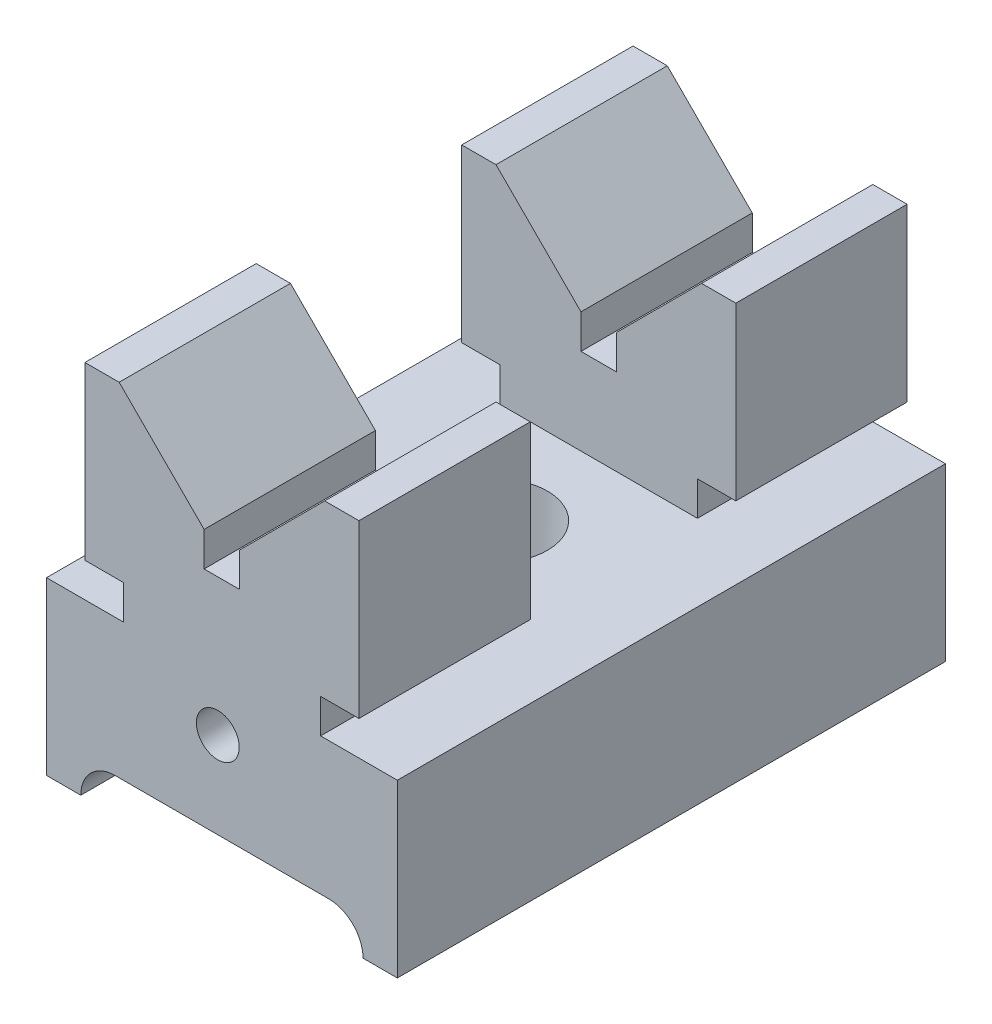
from build123d import *

# Parameters (mm, degrees)
BOSS_EXTRUDE1_DEPTH          = 101.6
FILLET1_R                    = 6.35
F_3_8_16_TAPPED_HOLE2_D      = 7.9375
F_3_8_16_TAPPED_HOLE2_DEPTH  = 16.002
F_3_8_16_TAPPED_HOLE2_TIP    = 2.384665582
SKETCH7_R                    = 9.525
CUT_EXTRUDE1_DEPTH           = 125.734690748
BOSS_EXTRUDE2_DEPTH          = 31.75
BOSS_EXTRUDE3_START          = -101.6
BOSS_EXTRUDE3_DEPTH          = 31.75
SKETCH9_R                    = 6.35
CUT_EXTRUDE2_DEPTH           = 3.175
F_3_8_16_TAPPED_HOLE3_REACH  = 139.938
F_3_8_16_TAPPED_HOLE3_BORE_R = 3.96875


with BuildPart() as part:
    # Sketch1 → Boss-Extrude1 (new body)
    with BuildSketch(Plane.XY):
        Polygon((0, 0), (0, 31.75), (65.024, 31.75), (65.024, 0), (58.674, 0), (58.674, 6.35), (6.35, 6.35), (6.35, 0), align=None)
    extrude(amount=-BOSS_EXTRUDE1_DEPTH)

    # Fillet1
    fillet1_edges = [part.edges().sort_by_distance(p)[0] for p in [
        (58.674, 6.35, -50.8),
        (6.35, 6.35, -50.8),
    ]]
    fillet(fillet1_edges, radius=FILLET1_R - 0.0001)  # a hair under: the kernel refuses the full size

    # 3/8-16 Tapped Hole2
    with Locations(Plane.XY):
        with Locations((31.75, 22.352)):
            Hole(F_3_8_16_TAPPED_HOLE2_D / 2, depth=F_3_8_16_TAPPED_HOLE2_DEPTH)
            with Locations((0, 0, -(F_3_8_16_TAPPED_HOLE2_DEPTH + F_3_8_16_TAPPED_HOLE2_TIP / 2))):  # 118° drill point
                Cone(0, F_3_8_16_TAPPED_HOLE2_D / 2, F_3_8_16_TAPPED_HOLE2_TIP, mode=Mode.SUBTRACT)

    # Sketch7 → Cut-Extrude1 (cut, through all)
    with BuildSketch(Plane(origin=(0, 31.75, 0), x_dir=(1, 0, 0), z_dir=(0, 1, 0))):
        with Locations(Location((32.512, 50.8, 0), (0, 0, 270))):
            Circle(SKETCH7_R)
    extrude(amount=-CUT_EXTRUDE1_DEPTH, mode=Mode.SUBTRACT)

    # Sketch8 → Boss-Extrude2 (add)
    with BuildSketch(Plane.XY):
        Polygon((14.224, 31.75), (14.224, 38.1), (7.112, 38.1), (7.112, 69.85), (13.462, 69.85), (29.21, 54.102), (29.21, 47.752), (35.814, 47.752), (35.814, 54.102), (51.562, 69.85), (57.912, 69.85), (57.912, 38.1), (50.8, 38.1), (50.8, 31.75), align=None)
    extrude(amount=-BOSS_EXTRUDE2_DEPTH)

    # Sketch8<3> → Boss-Extrude3 (add)
    with BuildSketch(Plane.XY.offset(BOSS_EXTRUDE3_START)):
        Polygon((14.224, 31.75), (14.224, 38.1), (7.112, 38.1), (7.112, 69.85), (13.462, 69.85), (29.21, 54.102), (29.21, 47.752), (35.814, 47.752), (35.814, 54.102), (51.562, 69.85), (57.912, 69.85), (57.912, 38.1), (50.8, 38.1), (50.8, 31.75), align=None)
    extrude(amount=BOSS_EXTRUDE3_DEPTH)

    # Sketch9 → Cut-Extrude2 (cut)
    with BuildSketch(Plane.ZY):
        with Locations((-50.8, 16.002)):
            Circle(SKETCH9_R)
    extrude(amount=-CUT_EXTRUDE2_DEPTH, mode=Mode.SUBTRACT)

    # 3/8-16 Tapped Hole3 bore → 3/8-16 Tapped Hole3 (cut, up to next)
    with BuildSketch(Plane.ZY.offset(-3.175), mode=Mode.PRIVATE) as f_3_8_16_tapped_hole3_sk1:
        with Locations((-50.8, 16.002)):
            Circle(F_3_8_16_TAPPED_HOLE3_BORE_R)
    f_3_8_16_tapped_hole3_tool1 = extrude(f_3_8_16_tapped_hole3_sk1.sketch, amount=-F_3_8_16_TAPPED_HOLE3_REACH, mode=Mode.PRIVATE) & part.part
    add(f_3_8_16_tapped_hole3_tool1.solids().sort_by_distance((3.175, 16.002, -50.8))[0], mode=Mode.SUBTRACT)


solid = part.part
